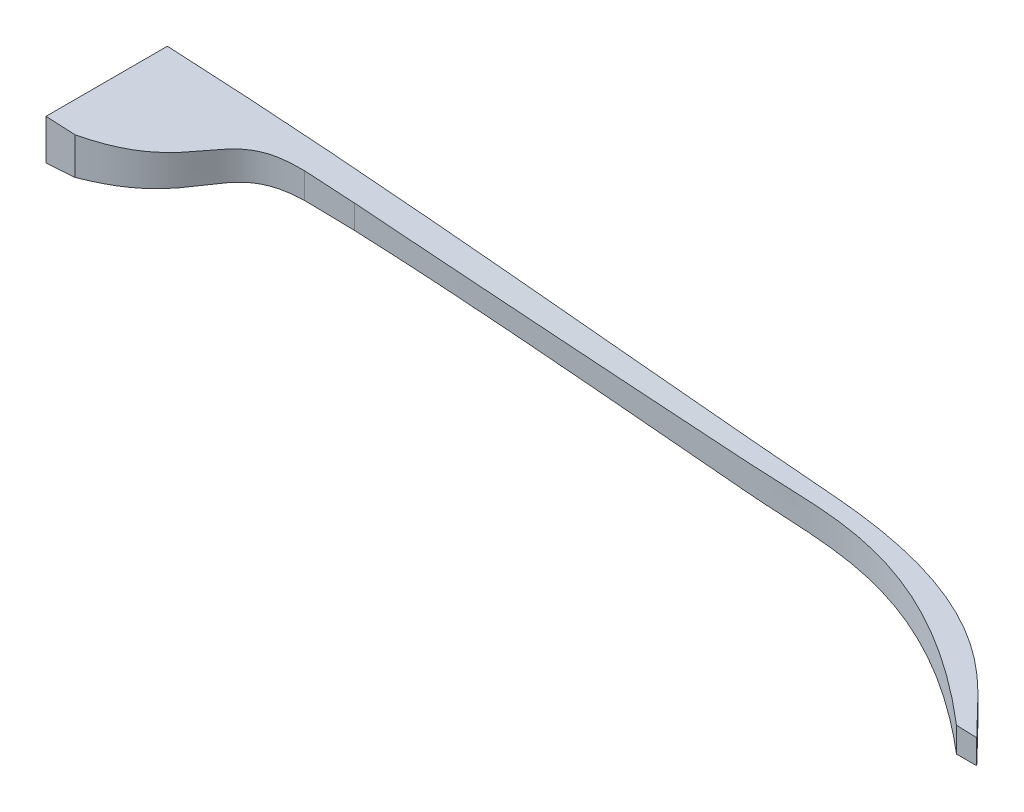
from build123d import *

# Parameters (mm, degrees)
SKETCH1_W           = 146.05
SKETCH1_H           = 19.05
BOSS_EXTRUDE1_DEPTH = 15.24
CUT_EXTRUDE2_DEPTH  = 19.05
CUT_EXTRUDE3_DEPTH  = 149.073504166
SKETCH5_W           = 6.35
SKETCH5_H           = 3.81
CUT_EXTRUDE4_DEPTH  = 5.08


with BuildPart() as part:
    # Sketch1 → Boss-Extrude1 (new body)
    with BuildSketch(Plane(origin=(0, 0, 0), x_dir=(1, 0, 0), z_dir=(0, 1, 0))):
        with Locations((73.025, 9.525)):
            Rectangle(SKETCH1_W, SKETCH1_H)
    extrude(amount=BOSS_EXTRUDE1_DEPTH)

    # Sketch4 → Cut-Extrude2 (cut)
    with BuildSketch(Plane(origin=(0, 15.24, 0), x_dir=(1, 0, 0), z_dir=(0, 1, 0))):
        with BuildLine():
            add(Edge.make_bspline(
                [(4.579568857, 0), (17.828601951, 4.043101895), (14.357154265, 13.220826345), (24.873740944, 14.458808887), (26.032734076, 14.535154009)],
                knots=[0, 0, 0, 0, 0.166900002, 0.185444447, 0.185444447, 0.185444447, 0.185444447], degree=3))
            Line((4.579568857, 0), (142.875, 0))
            add(Edge.make_bspline(
                [(142.875, 0), (121.093565481, 18.589864643), (105.982844678, 16.108411723), (87.99753305, 15.860940785), (52.196265211, 14.792564578), (33.760092594, 14.675948636)],
                knots=[0.357600574, 0.357600574, 0.357600574, 0.357600574, 0.819753517, 0.901209072, 1.136149759, 1.136149759, 1.136149759, 1.136149759], degree=3))
            Line((33.760092594, 14.675948636), (26.032734076, 14.535154009))
        make_face()
        with BuildLine():
            add(Edge.make_bspline(
                [(105.157866441, 19.05), (131.491281961, 18.918345897), (139.296835945, 6.588803862), (146.05, 0)],
                knots=[0.010622627, 0.010622627, 0.010622627, 0.010622627, 1, 1, 1, 1], degree=3))
            Line((146.05, 0), (146.05, 19.05))
            Line((146.05, 19.05), (105.157866441, 19.05))
        make_face()
    extrude(amount=-CUT_EXTRUDE2_DEPTH, mode=Mode.SUBTRACT)

    # Sketch3 → Cut-Extrude3 (cut, through all)
    with BuildSketch(Plane(origin=(0, 0, -19.05), x_dir=(-1, 0, 0), z_dir=(0, 0, -1))):
        with BuildLine():
            Line((0, 0), (0, 8.89))
            add(Edge.make_bspline(
                [(0, 8.89), (-46.341066899, 12.707749488), (-91.548412284, 0.725507607), (-137.561071088, 0)],
                knots=[0, 0, 0, 0, 0.942127237, 0.942127237, 0.942127237, 0.942127237], degree=3))
            Line((-137.561071088, 0), (0, 0))
        make_face()
        with BuildLine():
            add(Edge.make_bspline(
                [(0, 15.24), (-48.805104957, 12.96315713), (-97.217258145, 5.554020042), (-146.05, 3.81)],
                knots=[0, 0, 0, 0, 1, 1, 1, 1], degree=3))
            Line((0, 15.24), (-146.05, 15.24))
            Line((-146.05, 15.24), (-146.05, 3.81))
        make_face()
    extrude(amount=-CUT_EXTRUDE3_DEPTH, mode=Mode.SUBTRACT)

    # Sketch5 → Cut-Extrude4 (cut)
    with BuildSketch(Plane.ZY):
        with Locations((-9.525, 10.795)):
            Rectangle(SKETCH5_W, SKETCH5_H)
    extrude(amount=-CUT_EXTRUDE4_DEPTH, mode=Mode.SUBTRACT)


solid = part.part
